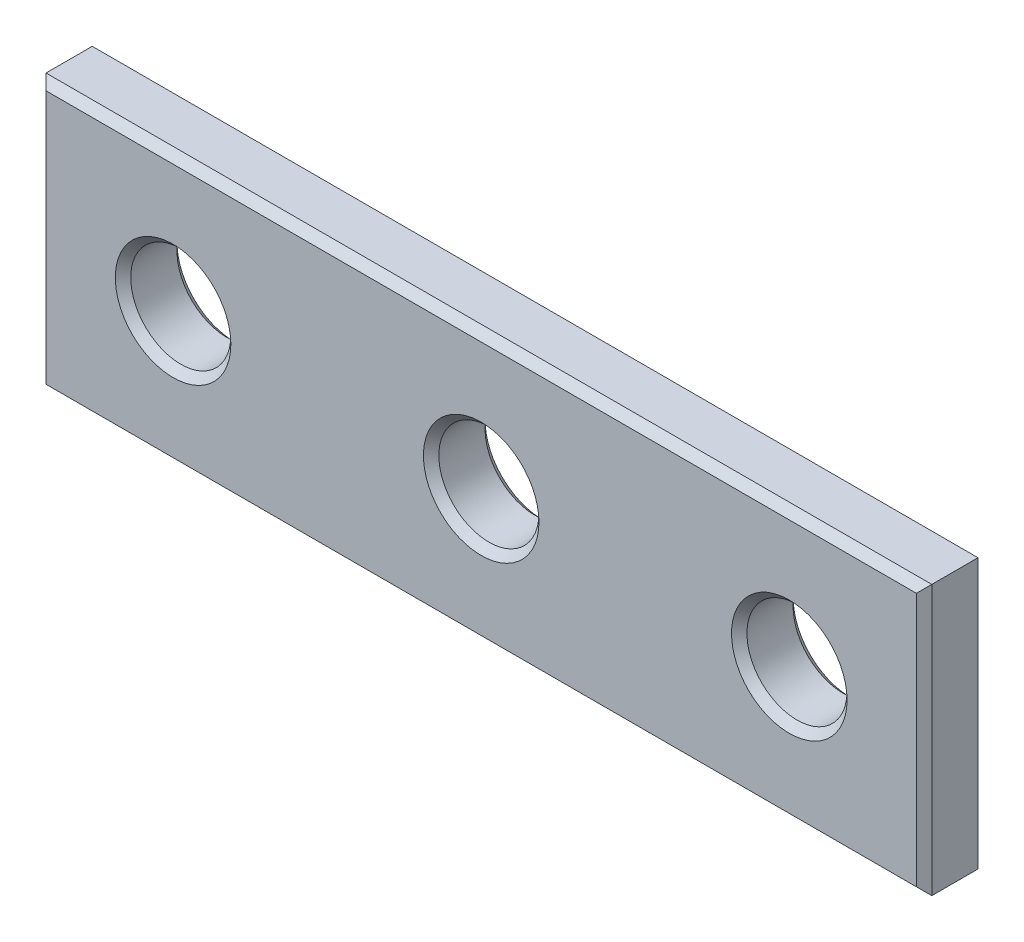
from build123d import *

# Parameters (mm, degrees)
SKETCH_1_W        = 230
SKETCH_1_H        = 70
SKETCH_1_R        = 13
EXTRUDE_327_DEPTH = 16
CHAMFER_1_SIZE    = 2


with BuildPart() as part:
    # 草图1 → Extrude 327 (new body)
    with BuildSketch(Plane.XY):
        Rectangle(SKETCH_1_W, SKETCH_1_H)
        Circle(SKETCH_1_R, mode=Mode.SUBTRACT)
        with Locations((80, 0)):
            Circle(SKETCH_1_R, mode=Mode.SUBTRACT)
        with Locations((-80, 0)):
            Circle(SKETCH_1_R, mode=Mode.SUBTRACT)
    extrude(amount=EXTRUDE_327_DEPTH)

    # 倒角1
    chamfer_1_edges = [part.edges().sort_by_distance(p)[0] for p in [
        (-93, 0, 0),
        (-13, 0, 0),
        (0, -35, 0),
        (115, 0, 0),
        (0, 35, 0),
        (-115, 0, 0),
        (67, 0, 0),
        (-93, 0, 16),
        (-13, 0, 16),
        (0, 35, 16),
        (115, 0, 16),
        (0, -35, 16),
        (-115, 0, 16),
        (67, 0, 16),
    ]]
    chamfer(chamfer_1_edges, length=CHAMFER_1_SIZE)


solid = part.part
